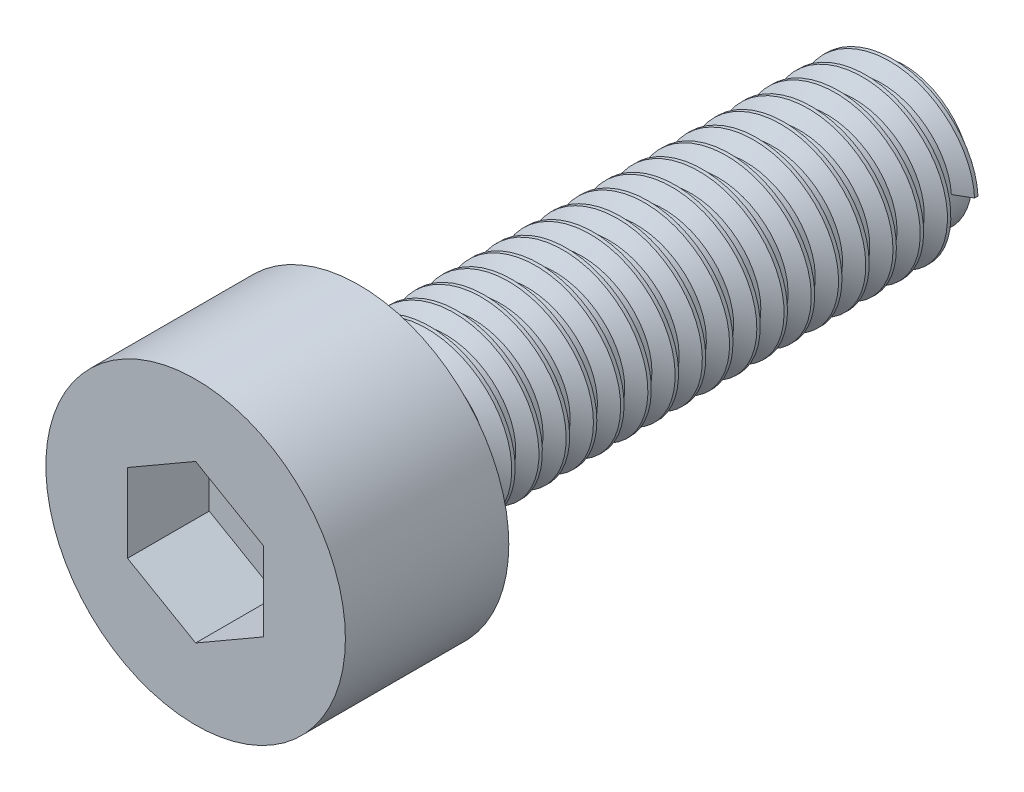
from build123d import *

# Parameters (mm, degrees)
SKETCH1_R           = 2.75
BOSS_EXTRUDE1_DEPTH = 3
SKETCH2_R           = 1.25
BOSS_EXTRUDE2_DEPTH = 10
CUT_EXTRUDE1_DEPTH  = 1.5
THREAD1_PITCH       = 0.5


with BuildPart() as part:
    # Sketch1 → Boss-Extrude1 (new body)
    with BuildSketch(Plane.XY):
        Circle(SKETCH1_R)
    extrude(amount=BOSS_EXTRUDE1_DEPTH)

    # Sketch2 → Boss-Extrude2 (add)
    with BuildSketch(Plane(origin=(0, 0, 0), x_dir=(-1, 0, 0), z_dir=(0, 0, -1))):
        Circle(SKETCH2_R)
    extrude(amount=BOSS_EXTRUDE2_DEPTH)

    # Sketch3 → Cut-Extrude1 (cut)
    with BuildSketch(Plane.XY.offset(3)):
        Polygon((0, 1.443375673), (-1.25, 0.721687836), (-1.25, -0.721687836), (0, -1.443375673), (1.25, -0.721687836), (1.25, 0.721687836), align=None)
    extrude(amount=-CUT_EXTRUDE1_DEPTH, mode=Mode.SUBTRACT)

    # Thread1: the profile of Thread Profile1 profile screwed along a right-hand helix of 20 turns, 6 arcs to a turn; built about Z, then put on its axis
    thread1_z = Axis((0, 0, 0), (0, 0, 1))
    thread1_corners = [(1.2497, 0, -0.000173205), (1.520632938, 0, 0.156249999), (1.520632937, 0, 0.218749999), (1.2497, 0, 0.375173204)]
    with BuildLine(mode=Mode.PRIVATE) as thread1_profile:
        Line(thread1_corners[0], thread1_corners[1])
        Line(thread1_corners[1], thread1_corners[2])
        Line(thread1_corners[2], thread1_corners[3])
        Line(thread1_corners[3], thread1_corners[0])
    thread1_cap = Face(thread1_profile.wire())
    thread1_turn_angles = [0, 30, 60, 90, 120, 150, 180, 210, 240, 270, 300, 330, 360]
    thread1_turn_weights = [1, 0.8660254037844387, 1, 0.8660254037844387, 1, 0.8660254037844387, 1, 0.8660254037844387, 1, 0.8660254037844387, 1, 0.8660254037844387, 1]
    thread1_turn_rails = [Edge.make_bspline([Vector(p[0], p[1], 0).rotate(thread1_z, thread1_turn_angles[k]) / thread1_turn_weights[k] + Vector(0, 0, p[2] + THREAD1_PITCH * thread1_turn_angles[k] / 360) for k in range(13)], [0, 0, 0, 1, 1, 2, 2, 3, 3, 4, 4, 5, 5, 6, 6, 6], 2, thread1_turn_weights) for p in thread1_corners]
    thread1_turn_sides = [Face.make_surface_from_curves(thread1_turn_rails[p[0]], thread1_turn_rails[p[1]]) for p in [(0, 1), (1, 2), (2, 3), (3, 0)]]
    thread1 = Plane(origin=(0, 0, -10), x_dir=(1, 0, 0), z_dir=(0, 0, 1)) * Solid(Shell([*[p.moved(Location((0, 0, THREAD1_PITCH * i))) for i in range(20) for p in thread1_turn_sides], thread1_cap, thread1_cap.rotate(thread1_z, 7200).moved(Location((0, 0, THREAD1_PITCH * 7200 / 360)))]))
    add(thread1)


solid = part.part
